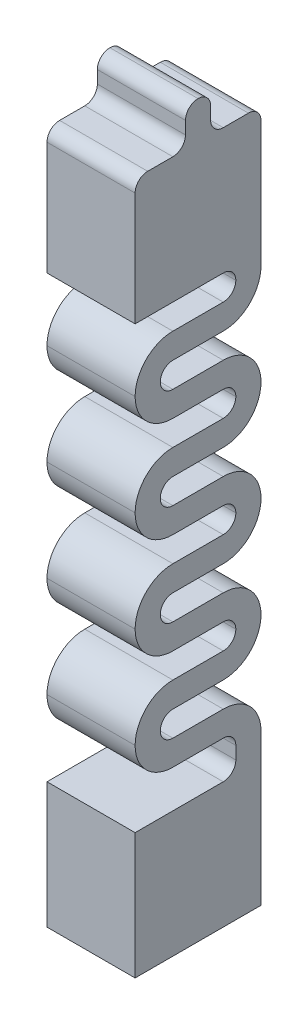
from build123d import *

# Parameters (mm, degrees)
AUFSATZ_LINEAR_AUSTRAGEN3_DEPTH = 2.8
VERRUNDUNG2_R                   = 0.4
VERRUNDUNG5_R                   = 1.2
VERRUNDUNG6_R                   = 1.2
LINEARES_MUSTER1_COUNT          = 5
LINEARES_MUSTER1_PITCH          = 3.2
SKIZZE5_W                       = 4
SKIZZE5_H                       = 4
AUFSATZ_LINEAR_AUSTRAGEN4_DEPTH = 2.8
VERRUNDUNG3_R                   = 0.4
VERRUNDUNG4_R                   = 0.4
VERRUNDUNG8_R                   = 1.2


# Read off the part's stored shape, not the designer's step: Aufsatz-Linear austragen3
with BuildPart() as part:
    # Aufsatz-Linear austragen3 outline → Aufsatz-Linear austragen3 (new body)
    with BuildSketch(Plane(origin=(84.3, 0, 0), x_dir=(0, 0, -1), z_dir=(1, 0, 0))):
        Polygon((11.9, 5.1), (11.9, 6.3), (11.1, 6.3), (11.1, 4.3), (12.7, 4.3), (12.7, 3.5), (9.5, 3.5), (9.5, 1.1), (12.7, 1.1), (12.7, -0.1), (13.5, -0.1), (13.5, 1.9), (10.3, 1.9), (10.3, 2.7), (13.5, 2.7), (13.5, 5.1), align=None)
    extrude(amount=AUFSATZ_LINEAR_AUSTRAGEN3_DEPTH)

    # Verrundung2
    verrundung2_edges = [part.edges().sort_by_distance(p)[0] for p in [
        (85.7, 1.9, -10.3),
        (85.7, 2.7, -10.3),
        (85.7, 3.5, -12.7),
        (85.7, 4.3, -12.7),
        (85.7, 5.1, -11.9),
        (85.7, 6.3, -11.1),
        (85.7, 6.3, -11.9),
        (85.7, 1.1, -12.7),
    ]]
    fillet(verrundung2_edges, radius=VERRUNDUNG2_R - 0.0001)  # a hair under: the kernel refuses the full size


with BuildPart() as body_2:
    # Abspalten1: the piece on the far side of the plane
    add(part.part)
    split(bisect_by=Plane.ZX.offset(3.5), keep=Keep.BOTTOM)

    # Verrundung5
    verrundung5_edges = [body_2.edges().sort_by_distance(p)[0] for p in [
        (85.7, 1.1, -9.5),
        (85.7, 3.5, -9.5),
    ]]
    fillet(verrundung5_edges, radius=VERRUNDUNG5_R - 0.0001)  # a hair under: the kernel refuses the full size


with BuildPart() as part_1:
    add(part.part)

    # Abspalten1
    split(bisect_by=Plane.ZX.offset(3.5), keep=Keep.TOP)

    # Verrundung6
    verrundung6_edges = [part_1.edges().sort_by_distance(p)[0] for p in [
        (85.7, 5.1, -13.5),
    ]]
    fillet(verrundung6_edges, radius=VERRUNDUNG6_R)


with BuildPart() as lineares_muster1_1:
    # Lineares Muster1: pattern copy
    add(body_2.part.moved(Location(Vector(0, -1, 0) * (1 * LINEARES_MUSTER1_PITCH))))


with BuildPart() as lineares_muster1_2:
    # Lineares Muster1: pattern copy
    add(body_2.part.moved(Location(Vector(0, -1, 0) * (2 * LINEARES_MUSTER1_PITCH))))


with BuildPart() as lineares_muster1_3:
    # Lineares Muster1: pattern copy
    add(body_2.part.moved(Location(Vector(0, -1, 0) * (3 * LINEARES_MUSTER1_PITCH))))


with BuildPart() as lineares_muster1_4:
    # Lineares Muster1: pattern copy
    add(body_2.part.moved(Location(Vector(0, -1, 0) * (4 * LINEARES_MUSTER1_PITCH))))

    # Skizze5 → Aufsatz-Linear austragen4 (add)
    with BuildSketch(Plane(origin=(84.3, 0, 0), x_dir=(0, 0, -1), z_dir=(1, 0, 0))):
        with Locations((11.5, -14.9)):
            Rectangle(SKIZZE5_W, SKIZZE5_H)
        with Locations((11.5, 3.1)):
            Rectangle(SKIZZE5_W, SKIZZE5_H)
    extrude(amount=AUFSATZ_LINEAR_AUSTRAGEN4_DEPTH)


with BuildPart() as aufsatz_linear_austragen4_piece_1:
    # of the separate pieces the step leaves, piece 1, a body of its own (aufsatz_linear_austragen4_pieces)
    add(lineares_muster1_4.part.solids().sort_by_distance((84.3, -9.3, -10.6999))[0])

    # Verrundung3
    verrundung3_edges = [aufsatz_linear_austragen4_piece_1.edges().sort_by_distance(p)[0] for p in [
        (85.7, -12.9, -12.7),
    ]]
    fillet(verrundung3_edges, radius=VERRUNDUNG3_R)


with BuildPart() as aufsatz_linear_austragen4_piece_2:
    # of the separate pieces the step leaves, piece 2, a body of its own (aufsatz_linear_austragen4_pieces)
    add(lineares_muster1_4.part.solids().sort_by_distance((84.3, 1.1, -9.5))[0])


with BuildPart() as part_2:
    add(part_1.part)

    # Kombinieren1: union body 2, Lineares Muster1_1, Lineares Muster1_2, Lineares Muster1_3, Aufsatz-Linear austragen4 piece 1, Aufsatz-Linear austragen4 piece 2
    add(body_2.part)
    add(lineares_muster1_1.part)
    add(lineares_muster1_2.part)
    add(lineares_muster1_3.part)
    add(aufsatz_linear_austragen4_piece_1.part)
    add(aufsatz_linear_austragen4_piece_2.part)

    # Verrundung4
    verrundung4_edges = [part_2.edges().sort_by_distance(p)[0] for p in [
        (85.7, 5.1, -11.1),
        (85.7, 5.1, -13.5),
        (85.7, 0.3, -12.7),
        (85.7, -2.9, -12.7),
        (85.7, -6.1, -12.7),
        (85.7, -9.3, -12.7),
        (85.7, 5.1, -9.5),
    ]]
    fillet(verrundung4_edges, radius=VERRUNDUNG4_R)

    # Verrundung8
    verrundung8_edges = [part_2.edges().sort_by_distance(p)[0] for p in [
        (85.7, -0.5, -13.5),
        (85.7, -3.7, -13.5),
        (85.7, -1.3, -13.5),
        (85.7, -6.9, -13.5),
        (85.7, -4.5, -13.5),
        (85.7, -10.1, -13.5),
        (85.7, -7.7, -13.5),
        (85.7, -10.9, -13.5),
    ]]
    fillet(verrundung8_edges, radius=VERRUNDUNG8_R - 0.0001)  # a hair under: the kernel refuses the full size


solid = part_2.part
